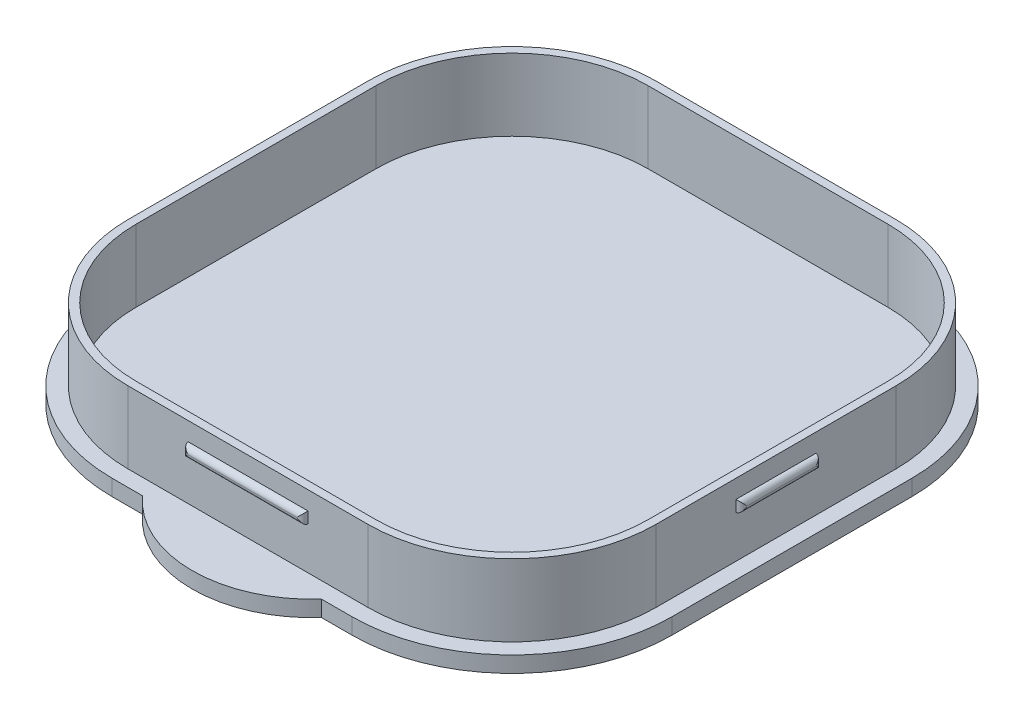
from build123d import *

# Parameters (mm, degrees)
EXTRUDE_1_DEPTH        = 2
FILLET_1_R             = 20
EXTRUDE_2_DEPTH        = 9
CUT_EXTRUDE_2_DEPTH    = 9
SKETCH_4_W             = 10
SKETCH_4_H             = 1.4
EXTRUDE_3_DEPTH        = 0.7
FILLET_2_R             = 0.7
FILLET_2_OF_MIRROR_1_R = 0.7
SKETCH_5_W             = 15
SKETCH_5_H             = 1.4
EXTRUDE_4_DEPTH        = 0.7
FILLET_3_R             = 0.7
FILLET_3_OF_MIRROR_2_R = 0.7


with BuildPart() as part:
    # 草图1 → 凸台-拉伸1 (new body)
    with BuildSketch(Plane(origin=(0, 0, 0), x_dir=(1, 0, 0), z_dir=(0, 1, 0))):
        with BuildLine():
            Line((-35, -35), (-11.180339887, -35))
            ThreePointArc((-11.180339887, -35), (0, -40), (11.180339887, -35))
            Line((11.180339887, -35), (35, -35))
            Line((35, -35), (35, 35))
            Line((35, 35), (11.180339887, 35))
            ThreePointArc((11.180339887, 35), (0, 40), (-11.180339887, 35))
            Line((-11.180339887, 35), (-35, 35))
            Line((-35, 35), (-35, -35))
        make_face()
    extrude(amount=EXTRUDE_1_DEPTH)

    # 圆角1
    fillet_1_edges = [part.edges().sort_by_distance(p)[0] for p in [
        (35, 1, -35),
        (35, 1, 35),
        (-35, 1, 35),
        (-35, 1, -35),
    ]]
    fillet(fillet_1_edges, radius=FILLET_1_R)

    # 草图2 → 凸台-拉伸2 (add)
    with BuildSketch(Plane(origin=(0, 2, 0), x_dir=(1, 0, 0), z_dir=(0, 1, 0))):
        with BuildLine():
            Line((-10.246950766, 33), (10.246950766, 33))
            Line((10.246950766, 33), (15, 33))
            ThreePointArc((15, 33), (27.727922061, 27.727922061), (33, 15))
            Line((33, 15), (33, -15))
            ThreePointArc((33, -15), (27.727922061, -27.727922061), (15, -33))
            Line((15, -33), (10.246950766, -33))
            Line((10.246950766, -33), (-10.246950766, -33))
            Line((-10.246950766, -33), (-15, -33))
            ThreePointArc((-15, -33), (-27.727922061, -27.727922061), (-33, -15))
            Line((-33, -15), (-33, 15))
            ThreePointArc((-33, 15), (-27.727922061, 27.727922061), (-15, 33))
            Line((-15, 33), (-10.246950766, 33))
        make_face()
    extrude(amount=EXTRUDE_2_DEPTH)

    # 草图3 → 切除-拉伸2 (cut)
    with BuildSketch(Plane(origin=(0, 11, 0), x_dir=(1, 0, 0), z_dir=(0, 1, 0))):
        with BuildLine():
            Line((-15, -32), (15, -32))
            ThreePointArc((15, -32), (27.02081528, -27.02081528), (32, -15))
            Line((32, -15), (32, 15))
            ThreePointArc((32, 15), (27.02081528, 27.02081528), (15, 32))
            Line((15, 32), (-15, 32))
            ThreePointArc((-15, 32), (-27.02081528, 27.02081528), (-32, 15))
            Line((-32, 15), (-32, -15))
            ThreePointArc((-32, -15), (-27.02081528, -27.02081528), (-15, -32))
        make_face()
    extrude(amount=-CUT_EXTRUDE_2_DEPTH, mode=Mode.SUBTRACT)

    # 草图4 → 凸台-拉伸3 (add)
    with BuildSketch(Plane.ZY.offset(33)):
        with Locations((0, 8)):
            Rectangle(SKETCH_4_W, SKETCH_4_H)
    extrude_3 = extrude(amount=EXTRUDE_3_DEPTH)

    # 圆角2
    fillet_2_edges = [part.edges().sort_by_distance(p)[0] for p in [
        (-33.7, 8, 5),
        (-33.7, 8, -5),
        (-33.7, 7.3, 0),
        (-33.7, 8.7, 0),
    ]]
    fillet(fillet_2_edges, radius=FILLET_2_R - 0.0001)  # a hair under: the kernel refuses the full size

    # 镜向1: 凸台-拉伸3 across plane
    add(extrude_3.mirror(Plane(origin=(0, 0, 0), x_dir=(0, 0, 1), z_dir=(1, 0, 0))))

    # 圆角2 of 镜向1
    fillet_2_of_mirror_1_edges = [part.edges().sort_by_distance(p)[0] for p in [
        (33.7, 8, 5),
        (33.7, 8, -5),
        (33.7, 7.3, 0),
        (33.7, 8.7, 0),
    ]]
    fillet(fillet_2_of_mirror_1_edges, radius=FILLET_2_OF_MIRROR_1_R - 0.0001)  # a hair under: the kernel refuses the full size

    # 草图5 → 凸台-拉伸4 (add)
    with BuildSketch(Plane.XY.offset(33)):
        with Locations((0, 8)):
            Rectangle(SKETCH_5_W, SKETCH_5_H)
    extrude_4 = extrude(amount=EXTRUDE_4_DEPTH)

    # 圆角3
    fillet_3_edges = [part.edges().sort_by_distance(p)[0] for p in [
        (0, 7.3, 33.7),
        (-7.5, 8, 33.7),
        (0, 8.7, 33.7),
        (7.5, 8, 33.7),
    ]]
    fillet(fillet_3_edges, radius=FILLET_3_R - 0.0001)  # a hair under: the kernel refuses the full size

    # 镜向2: 凸台-拉伸4 across plane
    add(extrude_4.mirror(Plane.XY))

    # 圆角3 of 镜向2
    fillet_3_of_mirror_2_edges = [part.edges().sort_by_distance(p)[0] for p in [
        (0, 7.3, -33.7),
        (-7.5, 8, -33.7),
        (0, 8.7, -33.7),
        (7.5, 8, -33.7),
    ]]
    fillet(fillet_3_of_mirror_2_edges, radius=FILLET_3_OF_MIRROR_2_R - 0.0001)  # a hair under: the kernel refuses the full size


solid = part.part
